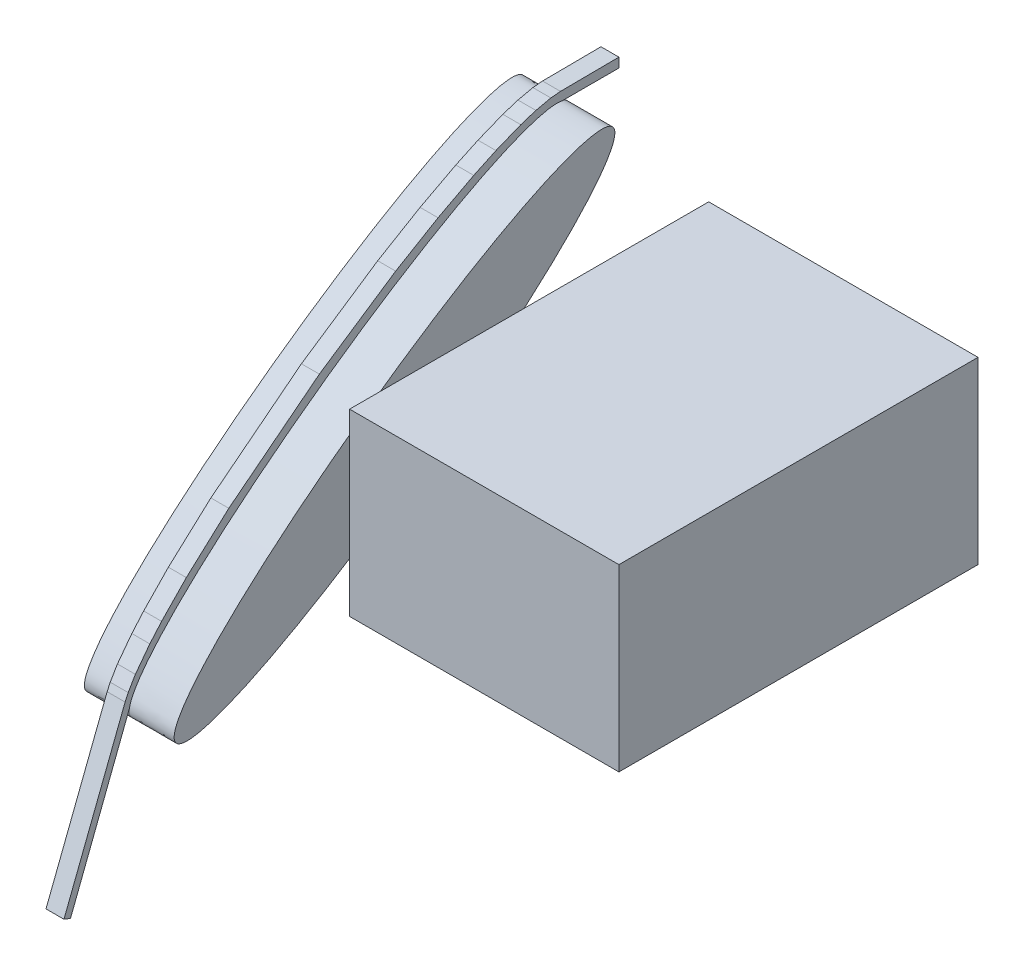
from build123d import *

# Parameters (mm, degrees)
SKETCH_1_W      = 30
SKETCH_1_H      = 20
EXTRUDE_1_DEPTH = 40
SKETCH_2_R      = 2
EXTRUDE_2_DEPTH = 5
SKETCH_3_RX     = 30
SKETCH_3_RY     = 5
EXTRUDE_3_DEPTH = 5
EXTRUDE_4_DEPTH = 2
EXTRUDE_5_DEPTH = 5


# Read off the part's stored shape, not the designer's step: 凸台-拉伸5
with BuildPart() as part:
    # 草图1 → 凸台-拉伸1 (new body)
    with BuildSketch(Plane.XY):
        with Locations((15, 10)):
            Rectangle(SKETCH_1_W, SKETCH_1_H)
    extrude(amount=EXTRUDE_1_DEPTH)

    # 草图2 → 凸台-拉伸2 (add)
    with BuildSketch(Plane.ZY):
        with Locations(Location((30, 10, 0), (0, 0, 180))):
            Circle(SKETCH_2_R)
    extrude(amount=EXTRUDE_2_DEPTH)

    # 草图3 → 凸台-拉伸3 (add)
    with BuildSketch(Plane.ZY.offset(5)):
        with Locations(Location((30, 10), (0, 0, 144.330167024))):
            Ellipse(SKETCH_3_RX, SKETCH_3_RY)
    extrude(amount=EXTRUDE_3_DEPTH)



with BuildPart() as body_2:
    # 草图4 → 凸台-拉伸4 (new body)
    with BuildSketch(Plane.ZY.offset(10)):
        with BuildLine():
            add(Edge.make_bspline(
                [(6.506952715, 28.909855834), (5.513332822, 28.917697958), (4.992779523, 28.561751889)],
                knots=[6.015569415, 6.015569415, 6.015569415, 6.212983263, 6.212983263, 6.212983263], degree=2, weights=[1, 0.995132426, 1]))
            Line((4.992779523, 28.561751889), (7.137480457, 27.953085866))
            add(Edge.make_bspline(
                [(8.41739908, 27.759268462), (7.691843708, 27.924954947), (7.137480457, 27.953085866)],
                knots=[5.905821209, 5.905821209, 5.905821209, 6.029787374, 6.029787374, 6.029787374], degree=2, weights=[1, 0.998079664, 1]))
            add(Edge.make_bspline(
                [(9.931154304, 27.32571063), (9.102712315, 27.602771598), (8.41739908, 27.759268462)],
                knots=[5.788714528, 5.788714528, 5.788714528, 5.905821209, 5.905821209, 5.905821209], degree=2, weights=[1, 0.998286243, 1]))
            add(Edge.make_bspline(
                [(12.213928034, 26.448131332), (10.970222869, 26.978208516), (9.931154304, 27.32571063)],
                knots=[5.641930178, 5.641930178, 5.641930178, 5.788714528, 5.788714528, 5.788714528], degree=2, weights=[1, 0.997308003, 1]))
            add(Edge.make_bspline(
                [(17.511716763, 23.85284507), (14.569327703, 25.444240976), (12.213928034, 26.448131332)],
                knots=[5.365220638, 5.365220638, 5.365220638, 5.641930178, 5.641930178, 5.641930178], degree=2, weights=[1, 0.990444236, 1]))
            add(Edge.make_bspline(
                [(21.663153618, 21.483483589), (19.49565109, 22.779830964), (17.511716763, 23.85284507)],
                knots=[5.17799572, 5.17799572, 5.17799572, 5.365220638, 5.365220638, 5.365220638], degree=2, weights=[1, 0.995621553, 1]))
            add(Edge.make_bspline(
                [(28.161833123, 17.358582765), (24.817516303, 19.596911494), (21.663153618, 21.483483589)],
                knots=[4.906410628, 4.906410628, 4.906410628, 5.17799572, 5.17799572, 5.17799572], degree=2, weights=[1, 0.990794351, 1]))
            add(Edge.make_bspline(
                [(31.719121271, 14.913354973), (29.940162996, 16.168358555), (28.161833123, 17.358582765)],
                knots=[4.761356742, 4.761356742, 4.761356742, 4.906410628, 4.906410628, 4.906410628], degree=2, weights=[1, 0.997371074, 1]))
            add(Edge.make_bspline(
                [(37.988291289, 10.282541681), (34.937566868, 12.642834742), (31.719121271, 14.913354973)],
                knots=[4.4999664, 4.4999664, 4.4999664, 4.761356742, 4.761356742, 4.761356742], degree=2, weights=[1, 0.991471536, 1]))
            add(Edge.make_bspline(
                [(44.627089911, 4.844191407), (41.578227004, 7.505070109), (37.988291289, 10.282541681)],
                knots=[4.193044565, 4.193044565, 4.193044565, 4.4999664, 4.4999664, 4.4999664], degree=2, weights=[1, 0.988247964, 1]))
            add(Edge.make_bspline(
                [(50.343902664, -0.577200355), (47.99639472, 1.903648758), (44.627089911, 4.844191407)],
                knots=[3.854449116, 3.854449116, 3.854449116, 4.193044565, 4.193044565, 4.193044565], degree=2, weights=[1, 0.985703337, 1]))
            add(Edge.make_bspline(
                [(52.4832091, -3.016334631), (51.589789327, -1.893854823), (50.343902664, -0.577200355)],
                knots=[3.673505786, 3.673505786, 3.673505786, 3.854449116, 3.854449116, 3.854449116], degree=2, weights=[1, 0.99591023, 1]))
            add(Edge.make_bspline(
                [(53.450493398, -4.328804293), (53.040359197, -3.716330033), (52.4832091, -3.016334631)],
                knots=[3.56047839, 3.56047839, 3.56047839, 3.673505786, 3.673505786, 3.673505786], degree=2, weights=[1, 0.998403526, 1]))
            add(Edge.make_bspline(
                [(54.25730413, -5.755095942), (53.982230556, -5.122874432), (53.450493398, -4.328804293)],
                knots=[3.414044896, 3.414044896, 3.414044896, 3.56047839, 3.56047839, 3.56047839], degree=2, weights=[1, 0.997320851, 1]))
            add(Edge.make_bspline(
                [(54.515784231, -6.566048985), (54.452837221, -6.2045038), (54.25730413, -5.755095942)],
                knots=[3.309862159, 3.309862159, 3.309862159, 3.414044896, 3.414044896, 3.414044896], degree=2, weights=[1, 0.998643551, 1]))
            Line((54.515784231, -6.566048985), (55.035975621, -7.912515095))
            add(Edge.make_bspline(
                [(55.035975621, -7.912515095), (55.571319453, -7.205458838), (55.0082883, -5.755095942)],
                knots=[3.136655758, 3.136655758, 3.136655758, 3.430060288, 3.430060288, 3.430060288], degree=2, weights=[1, 0.989258508, 1]))
            Line((55.0082883, -5.755095942), (54.668462814, -5.006548181))
            Line((54.668462814, -5.006548181), (53.860777814, -3.651060405))
            Line((53.860777814, -3.651060405), (52.255398503, -1.516776462))
            Line((52.255398503, -1.516776462), (50.940415781, 0))
            Line((50.940415781, 0), (48.186919212, 2.84562684))
            Line((48.186919212, 2.84562684), (43.454466091, 7.163503062))
            Line((43.454466091, 7.163503062), (33.368126059, 15.062192859))
            Line((33.368126059, 15.062192859), (24.869605616, 20.749286032))
            Line((24.869605616, 20.749286032), (20.147321799, 23.537005238))
            Line((20.147321799, 23.537005238), (16.169043828, 25.636582623))
            Line((16.169043828, 25.636582623), (13.69703985, 26.794407183))
            Line((13.69703985, 26.794407183), (10.928759246, 27.90628218))
            Line((10.928759246, 27.90628218), (9.248929013, 28.444330815))
            Line((9.248929013, 28.444330815), (7.585869147, 28.814585944))
            Line((7.585869147, 28.814585944), (6.506952715, 28.909855834))
        make_face()
        with BuildLine():
            Line((3.687796669, 28.932105961), (4.992779523, 28.561751889))
            add(Edge.make_bspline(
                [(6.506952715, 28.909855834), (5.513332822, 28.917697958), (4.992779523, 28.561751889)],
                knots=[6.015569415, 6.015569415, 6.015569415, 6.212983263, 6.212983263, 6.212983263], degree=2, weights=[1, 0.995132426, 1]))
            Line((6.506952715, 28.909855834), (3.687796669, 28.932105961))
        make_face()
        with BuildLine():
            Line((0, 28.264369192), (4.685334353, 28.264369192))
            add(Edge.make_bspline(
                [(4.992779523, 28.561751889), (4.808192105, 28.435533949), (4.685334353, 28.264369192)],
                knots=[6.212983263, 6.212983263, 6.212983263, 6.283185307, 6.283185307, 6.283185307], degree=2, weights=[1, 0.999384022, 1]))
            Line((4.992779523, 28.561751889), (3.687796669, 28.932105961))
            Line((3.687796669, 28.932105961), (0, 28.961211815))
            Line((0, 28.961211815), (0, 28.264369192))
        make_face()
        with BuildLine():
            add(Edge.make_bspline(
                [(4.685334353, 28.264369192), (4.57062955, 28.10456308), (4.510252037, 27.90628218)],
                knots=[0, 0, 0, 0.065546828, 0.065546828, 0.065546828], degree=2, weights=[1, 0.999463, 1]))
            Line((4.685334353, 28.264369192), (0, 28.264369192))
            Line((0, 28.264369192), (0, 27.90628218))
            Line((0, 27.90628218), (4.510252037, 27.90628218))
        make_face()
        with BuildLine():
            add(Edge.make_bspline(
                [(4.992779523, 28.561751889), (4.808192105, 28.435533949), (4.685334353, 28.264369192)],
                knots=[6.212983263, 6.212983263, 6.212983263, 6.283185307, 6.283185307, 6.283185307], degree=2, weights=[1, 0.999384022, 1]))
            add(Edge.make_bspline(
                [(4.685334353, 28.264369192), (4.57062955, 28.10456308), (4.510252037, 27.90628218)],
                knots=[0, 0, 0, 0.065546828, 0.065546828, 0.065546828], degree=2, weights=[1, 0.999463, 1]))
            Line((4.510252037, 27.90628218), (6.34848035, 27.90628218))
            add(Edge.make_bspline(
                [(7.137480457, 27.953085866), (6.682690118, 27.976164001), (6.34848035, 27.90628218)],
                knots=[6.029787374, 6.029787374, 6.029787374, 6.131529727, 6.131529727, 6.131529727], degree=2, weights=[1, 0.998706341, 1]))
            Line((7.137480457, 27.953085866), (4.992779523, 28.561751889))
        make_face()
        with BuildLine():
            add(Edge.make_bspline(
                [(55.035975621, -7.912515095), (55.571319453, -7.205458838), (55.0082883, -5.755095942)],
                knots=[3.136655758, 3.136655758, 3.136655758, 3.430060288, 3.430060288, 3.430060288], degree=2, weights=[1, 0.989258508, 1]))
            Line((55.035975621, -7.912515095), (61.090316434, -23.583602479))
            Line((61.090316434, -23.583602479), (61.819897807, -23.301737273))
            Line((61.819897807, -23.301737273), (55.0082883, -5.755095942))
        make_face()
    extrude(amount=EXTRUDE_4_DEPTH)


with BuildPart() as part_1:
    add(part.part)

    add(body_2.part)  # 凸台-拉伸5 merges body 2
    # 凸台-拉伸5 outline → 凸台-拉伸5 (add)
    with BuildSketch(Plane.ZY.offset(10)):
        with BuildLine():
            add(Edge.make_bspline(
                [(54.371719706, -7.493406717), (54.465505659, -7.362744634), (54.529944837, -7.206425025), (54.561913477, -7.022620585), (54.558192199, -6.809625231), (54.202681657, -4.767699434), (51.727605158, -1.240686466), (46.200440793, 4.025468627), (39.039651813, 9.679286683), (26.386377317, 18.734970385), (18.758776419, 23.664893419), (12.075170793, 27.137730816), (8.050806871, 28.262231314), (4.642942369, 27.549661544), (4.877580773, 25.652182817), (7.730736464, 22.205445776), (11.438087078, 18.596318521), (22.095709136, 9.277375664), (34.757298876, -0.521475217), (47.784810652, -8.095593664), (53.361737398, -8.90050861), (54.371719706, -7.493406717)],
                knots=[0, 0, 0, 0, 0, 0, 0.194483448, 0.194483448, 0.194483448, 0.194483448, 1.630375604, 1.630375604, 1.630375604, 1.630375604, 3.066267761, 3.066267761, 3.066267761, 3.066267761, 4.504868745, 4.504868745, 4.504868745, 4.504868745, 7.04748776, 7.04748776, 7.04748776, 7.04748776, 7.04748776, 7.04748776], degree=5, weights=[1, 1, 1.000007219, 1.000006403, 1, 1, 0.977216815, 0.977216815, 1, 1, 0.977216815, 0.977216815, 1, 1, 0.990702131, 0.997630061, 1, 1, 0.9, 0.9, 1, 1]))
        make_face()
    extrude(amount=EXTRUDE_5_DEPTH)


solid = part_1.part
